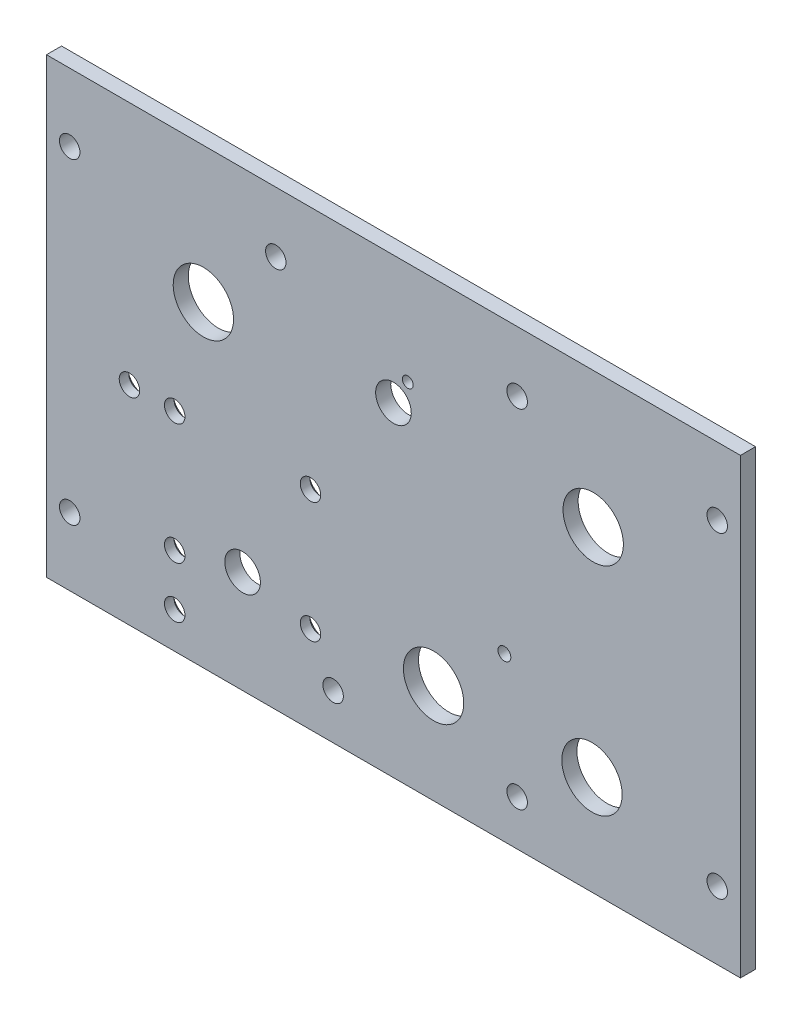
from build123d import *

# Parameters (mm, degrees)
SKETCH1_W                                         = 146.05
SKETCH1_H                                         = 95.25
BOSS_EXTRUDE1_DEPTH                               = 3.175
F_6_CLEARANCE_HOLE1_D                             = 4.3053
SKETCH5_R                                         = 6.35
SKETCH5_R_2                                       = 3.75
CUT_EXTRUDE1_DEPTH                                = 175.524869431
CSK_FOR_6_FLAT_HEAD_MACHINE_SCREW_100_D           = 4.3053
CSK_FOR_6_FLAT_HEAD_MACHINE_SCREW_100_CSINK_D     = 7.0866
CSK_FOR_6_FLAT_HEAD_MACHINE_SCREW_100_CSINK_ANGLE = 100
SKETCH8_R                                         = 1.134488875
CUT_EXTRUDE2_DEPTH                                = 175.39393804
CSK_FOR_2_FLAT_HEAD_MACHINE_SCREW_100_D           = 2.7051
CSK_FOR_2_FLAT_HEAD_MACHINE_SCREW_100_CSINK_D     = 4.3688
CSK_FOR_2_FLAT_HEAD_MACHINE_SCREW_100_CSINK_ANGLE = 100


with BuildPart() as part:
    # Sketch1 → Boss-Extrude1 (new body)
    with BuildSketch(Plane.XY):
        with Locations((-73.025, 47.625)):
            Rectangle(SKETCH1_W, SKETCH1_H)
    extrude(amount=-BOSS_EXTRUDE1_DEPTH)

    # #6 Clearance Hole1 (through all)
    with Locations(Plane(origin=(0, 0, -3.175), x_dir=(-1, 0, 0), z_dir=(0, 0, -1))):
        with Locations((4.8895, 80.9625), (141.1605, 80.9625), (141.1605, 14.2875), (4.8895, 14.2875), (46.99, 9.525), (85.725, 9.525), (97.79, 82.55), (46.99, 82.55)):
            Hole(F_6_CLEARANCE_HOLE1_D / 2)

    # Sketch5 → Cut-Extrude1 (cut, through all)
    with BuildSketch(Plane(origin=(0, 0, -7.4676), x_dir=(-1, 0, 0), z_dir=(0, 0, -1))):
        with Locations((30.988, 66.675)):
            Circle(SKETCH5_R)
        with Locations((113.03, 66.675)):
            Circle(SKETCH5_R)
        with Locations((64.5795, 20.955)):
            Circle(SKETCH5_R)
        with Locations((31.242, 20.955)):
            Circle(SKETCH5_R)
        with Locations((73.025, 68.326)):
            Circle(SKETCH5_R_2)
        with Locations((104.775, 21.59)):
            Circle(SKETCH5_R_2)
    extrude(amount=-CUT_EXTRUDE1_DEPTH, mode=Mode.SUBTRACT)

    # CSK for #6 Flat Head Machine Screw (100)1 (through all)
    with Locations(Plane(origin=(0, 0, -3.175), x_dir=(-1, 0, 0), z_dir=(0, 0, -1))):
        with Locations((90.4875, 43.815), (90.4875, 18.415), (119.0625, 7.636172046), (119.0625, 18.415), (119.0625, 43.815), (128.5875, 43.815)):
            CounterSinkHole(CSK_FOR_6_FLAT_HEAD_MACHINE_SCREW_100_D / 2, CSK_FOR_6_FLAT_HEAD_MACHINE_SCREW_100_CSINK_D / 2, counter_sink_angle=CSK_FOR_6_FLAT_HEAD_MACHINE_SCREW_100_CSINK_ANGLE)

    # Sketch8 → Cut-Extrude2 (cut, through all)
    with BuildSketch(Plane.XY):
        with Locations((-70.012401844, 73.606641948)):
            Circle(SKETCH8_R)
    extrude(amount=-CUT_EXTRUDE2_DEPTH, mode=Mode.SUBTRACT)

    # CSK for #2 Flat Head Machine Screw (100)1 (through all)
    with Locations(Plane(origin=(0, 0, -3.175), x_dir=(-1, 0, 0), z_dir=(0, 0, -1))):
        with Locations((49.68, 34.2646)):
            CounterSinkHole(CSK_FOR_2_FLAT_HEAD_MACHINE_SCREW_100_D / 2, CSK_FOR_2_FLAT_HEAD_MACHINE_SCREW_100_CSINK_D / 2, counter_sink_angle=CSK_FOR_2_FLAT_HEAD_MACHINE_SCREW_100_CSINK_ANGLE)


solid = part.part
